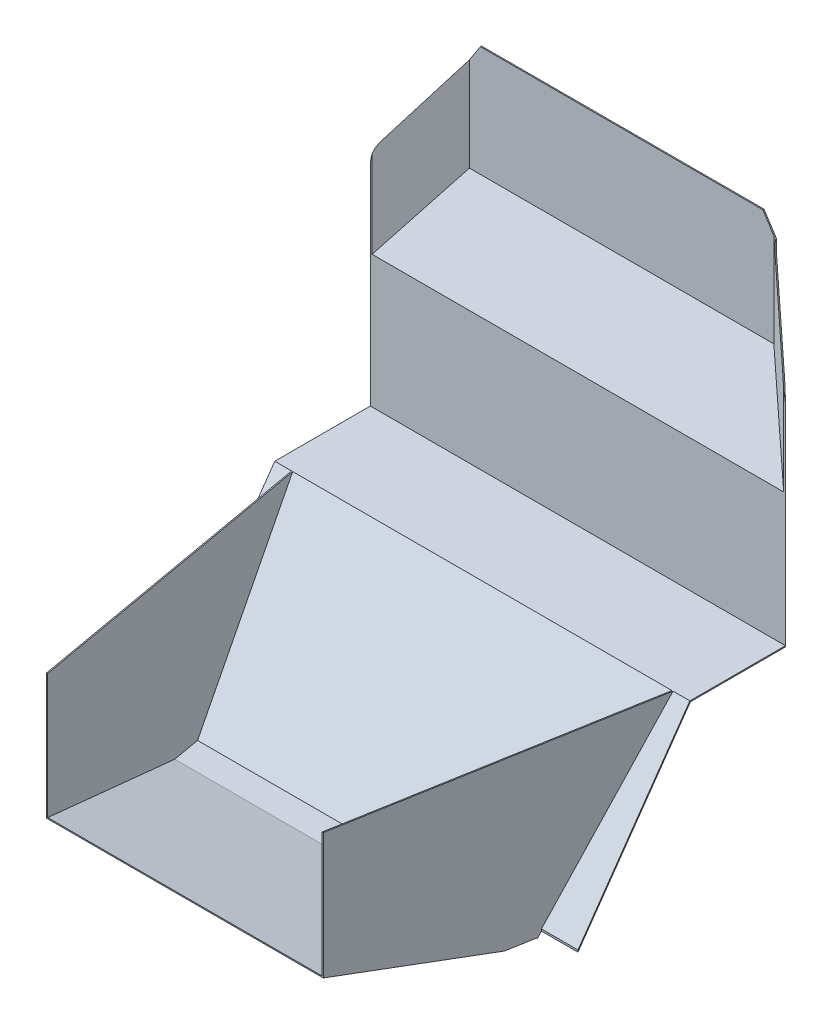
from build123d import *

# Parameters (mm, degrees)
SKETCH2_W                        = 750
SKETCH2_H                        = 2
CUT_EXTRUDE1_START               = -75.747152873
CUT_EXTRUDE1_DEPTH               = 12.429918895
BOSS_EXTRUDE8_DEPTH              = 2
BOSS_EXTRUDE9_REACH              = 1300.889
CUT_EXTRUDE2_DEPTH               = 1250.387389222
CUT_EXTRUDE2_DEPTH_BACK          = 1250.387389222
BOSS_EXTRUDE11_REACH             = 1244.792
CUT_EXTRUDE4_DEPTH               = 1243.792388557
CUT_EXTRUDE4_DEPTH_BACK          = 1243.792388557
SKETCH9_5_W                      = 96.83734937
SKETCH9_5_H                      = 2
CUT_EXTRUDE5_DEPTH               = 1250.387389222
CUT_EXTRUDE5_DEPTH_BACK          = 1250.387389222
BOSS_EXTRUDE12_REACH             = 1251.387
BOSS_EXTRUDE12_DIRECTION_2_REACH = 1251.387
CUT_EXTRUDE6_DEPTH               = 1250.387389222


# Read off the part's stored shape, not the designer's step: Cut-Extrude1
with BuildPart() as part:
    # Sweep1: sweep along a path in Sketch1
    with BuildLine(Plane(origin=(0, 0, 0), x_dir=(0, 0, -1), z_dir=(1, 0, 0))) as sweep1_path:
        Line((412.09972218, -74.6), (622.161983643, 225.4))
        Line((622.161983643, 225.4), (794.855002782, 225.4))
        Line((794.855002782, 225.4), (794.855002782, 464.406679147))
        Line((794.855002782, 464.406679147), (873.906828676, 608.165252796))
        Line((873.906828676, 608.165252796), (873.906828676, 808.165252796))
    # Sketch2 → Sweep1 (sweep)
    with BuildSketch(Plane(origin=(0, 808.165252796, -873.906828676), x_dir=(-1, 0, 0), z_dir=(0, -1, 0))):
        with Locations((0, 1)):
            Rectangle(SKETCH2_W, SKETCH2_H)
    sweep(path=sweep1_path.line, transition=Transition.RIGHT)

    # Cut-Extrude1 outline → Cut-Extrude1 (cut)
    with BuildSketch(Plane(origin=(0, 0, 0), x_dir=(1, 0, 0), z_dir=(0, 1, 0)).offset(CUT_EXTRUDE1_START)):
        Polygon((309.004636298, 420), (250, 84.852470497), (375, 84.852470497), (375, 420), align=None)
        Polygon((-375, 84.852470497), (-250, 84.852470497), (-309.004636298, 420), (-375, 420), align=None)
    extrude(amount=CUT_EXTRUDE1_DEPTH, mode=Mode.SUBTRACT)

    # Sketch5 → Boss-Extrude8 (add)
    with BuildSketch(Plane(origin=(0, -74.6, 0), x_dir=(1, 0, 0), z_dir=(0, 1, 0))):
        Polygon((250, 84.852470497), (307.902180066, 413.738026268), (-307.902180066, 413.738026268), (-250, 84.852470497), align=None)
    extrude(amount=BOSS_EXTRUDE8_DEPTH)

    # Boss-Extrude9: up to this face of the body (flat: up to its plane)
    boss_extrude9_end = Plane(part.part.faces().sort_by_distance((0, 225.4, -708.508493212))[0])
    # Sketch7 → Boss-Extrude9 (add, up to the picked face)
    with BuildSketch(Plane(origin=(0, -74.6, 0), x_dir=(1, 0, 0), z_dir=(0, 1, 0)), mode=Mode.PRIVATE) as boss_extrude9_sk1:
        Polygon((247.969240917, 84.852470497), (250, 84.852470497), (375, 794.855002782), (372.969240917, 794.855002782), align=None)
    boss_extrude9_tool1 = split(extrude(boss_extrude9_sk1.sketch, amount=BOSS_EXTRUDE9_REACH, mode=Mode.PRIVATE), bisect_by=boss_extrude9_end, keep=Keep.BOTH, mode=Mode.PRIVATE)
    # Sketch7 → Boss-Extrude9 (add, up to the picked face)
    with BuildSketch(Plane(origin=(0, -74.6, 0), x_dir=(1, 0, 0), z_dir=(0, 1, 0)), mode=Mode.PRIVATE) as boss_extrude9_sk2:
        Polygon((-250, 84.852470497), (-247.969240917, 84.852470497), (-372.969240917, 794.855002782), (-375, 794.855002782), align=None)
    boss_extrude9_tool2 = split(extrude(boss_extrude9_sk2.sketch, amount=BOSS_EXTRUDE9_REACH, mode=Mode.PRIVATE), bisect_by=boss_extrude9_end, keep=Keep.BOTH, mode=Mode.PRIVATE)
    add(boss_extrude9_tool1.solids().sort_by(Axis((311.48462, -74.6, -439.853737), (0, 1, 0)))[0])
    add(boss_extrude9_tool2.solids().sort_by(Axis((-311.48462, -74.6, -439.853737), (0, 1, 0)))[0])

    # Sketch8 → Cut-Extrude2 (cut, two sides: drawn at the far end of the back side and taken through both)
    with BuildSketch(Plane(origin=(0, 0, 0), x_dir=(0, 0, -1), z_dir=(1, 0, 0)).offset(-CUT_EXTRUDE2_DEPTH_BACK)):
        Polygon((794.855002782, -75.747152873), (413.738026268, -75.747152873), (623.203117744, 223.4), (794.855002782, 223.4), align=None)
    extrude(amount=CUT_EXTRUDE2_DEPTH + CUT_EXTRUDE2_DEPTH_BACK, mode=Mode.SUBTRACT)

    # Boss-Extrude11: up to this plane
    boss_extrude11_end = Plane(origin=(375, 608.747952644, -874.227251213), z_dir=(0, 0.48184672916330257, 0.8762555161564617))
    # Sketch9 → Boss-Extrude11 (add, up to the surface)
    with BuildSketch(Plane(origin=(0, 808.165252796, -873.906828676), x_dir=(-1, 0, 0), z_dir=(0, -1, 0)), mode=Mode.PRIVATE) as boss_extrude11_sk1:
        Polygon((278.16265063, 0), (375, -79.051825894), (371.837349371, -79.051825894), (275, 0), align=None)
    boss_extrude11_tool1 = split(extrude(boss_extrude11_sk1.sketch, amount=BOSS_EXTRUDE11_REACH, mode=Mode.PRIVATE), bisect_by=boss_extrude11_end, keep=Keep.BOTH, mode=Mode.PRIVATE)
    add(boss_extrude11_tool1.solids().sort_by_distance((-325, 808.165253, -834.380916))[0])
    # Sketch9 → Boss-Extrude11 (add, up to the surface)
    with BuildSketch(Plane(origin=(0, 808.165252796, -873.906828676), x_dir=(-1, 0, 0), z_dir=(0, -1, 0)), mode=Mode.PRIVATE) as boss_extrude11_sk2:
        Polygon((-278.16265063, 0), (-275, 0), (-371.837349371, -79.051825894), (-375, -79.051825894), align=None)
    boss_extrude11_tool2 = split(extrude(boss_extrude11_sk2.sketch, amount=BOSS_EXTRUDE11_REACH, mode=Mode.PRIVATE), bisect_by=boss_extrude11_end, keep=Keep.BOTH, mode=Mode.PRIVATE)
    add(boss_extrude11_tool2.solids().sort_by_distance((325, 808.165253, -834.380916))[0])

    # Sketch9<5> → Cut-Extrude4 (cut, two sides: drawn at the far end of the back side and taken through both)
    with BuildSketch(Plane(origin=(0, 808.165252796, -873.906828676), x_dir=(-1, 0, 0), z_dir=(0, -1, 0)).offset(-CUT_EXTRUDE4_DEPTH_BACK)):
        with Locations((326.581325315, 1)):
            Rectangle(SKETCH9_5_W, SKETCH9_5_H)
        Polygon((375, 0), (278.16265063, 0), (375, -79.051825894), align=None)
        with Locations((-326.581325315, 1)):
            Rectangle(SKETCH9_5_W, SKETCH9_5_H)
        Polygon((-278.16265063, 0), (-375, 0), (-375, -79.051825894), align=None)
    extrude(amount=CUT_EXTRUDE4_DEPTH + CUT_EXTRUDE4_DEPTH_BACK, mode=Mode.SUBTRACT)

    # Sketch10 → Cut-Extrude5 (cut, two sides: drawn at the far end of the back side and taken through both)
    with BuildSketch(Plane(origin=(0, 0, 0), x_dir=(0, 0, -1), z_dir=(1, 0, 0)).offset(-CUT_EXTRUDE5_DEPTH_BACK)):
        Polygon((363.31001592, -74.6), (84.852470497, -2.066737554), (84.852470497, -74.6), align=None)
    extrude(amount=CUT_EXTRUDE5_DEPTH + CUT_EXTRUDE5_DEPTH_BACK, mode=Mode.SUBTRACT)

    # Boss-Extrude12: up to this face of the body (flat: up to its plane)
    boss_extrude12_end = Plane(part.part.faces().sort_by_distance((290.698054418, 99.199933477, -316.018244063))[0])
    # Sketch10<3> → Boss-Extrude12 (add, up to the picked face)
    with BuildSketch(Plane(origin=(0, 0, 0), x_dir=(0, 0, -1), z_dir=(1, 0, 0)), mode=Mode.PRIVATE) as boss_extrude12_sk1:
        Polygon((371.244288377, -74.6), (84.852470497, 0), (84.852470497, -2.066737554), (363.31001592, -74.6), align=None)
    boss_extrude12_tool1 = split(extrude(boss_extrude12_sk1.sketch, amount=BOSS_EXTRUDE12_REACH, mode=Mode.PRIVATE), bisect_by=boss_extrude12_end, keep=Keep.BOTH, mode=Mode.PRIVATE)
    add(boss_extrude12_tool1.solids().sort_by(Axis((0, -37.814265, -226.074099), (1, 0, 0)))[0])

    # Boss-Extrude12 direction 2: up to this face of the body (flat: up to its plane)
    boss_extrude12_direction_2_end = Plane(part.part.faces().sort_by_distance((-290.698054418, 99.199933477, -316.018244063))[0])
    # Sketch10<3> → Boss-Extrude12 direction 2 (add, up to the picked face)
    with BuildSketch(Plane(origin=(0, 0, 0), x_dir=(0, 0, -1), z_dir=(1, 0, 0)), mode=Mode.PRIVATE) as boss_extrude12_direction_2_sk1:
        Polygon((371.244288377, -74.6), (84.852470497, 0), (84.852470497, -2.066737554), (363.31001592, -74.6), align=None)
    boss_extrude12_direction_2_tool1 = split(extrude(boss_extrude12_direction_2_sk1.sketch, amount=-BOSS_EXTRUDE12_DIRECTION_2_REACH, mode=Mode.PRIVATE), bisect_by=boss_extrude12_direction_2_end, keep=Keep.BOTH, mode=Mode.PRIVATE)
    add(boss_extrude12_direction_2_tool1.solids().sort_by(Axis((0, -37.814265, -226.074099), (-1, 0, 0)))[0])

    # Sketch11 → Cut-Extrude6 (cut, through all)
    with BuildSketch(Plane.XY):
        with BuildLine():
            Line((-132.091535468, 997.705769529), (-362.091535468, 643.574371694))
            ThreePointArc((-362.091535468, 643.574371694), (-371.70502864, 622.723084766), (-375, 600))
            Line((-375, 600), (-375, 997.705769529))
            Line((-375, 997.705769529), (-132.091535468, 997.705769529))
        make_face()
        with BuildLine():
            Line((132.091535468, 997.705769529), (362.091535468, 643.574371694))
            ThreePointArc((362.091535468, 643.574371694), (371.70502864, 622.723084766), (375, 600))
            Line((375, 600), (375, 997.705769529))
            Line((375, 997.705769529), (132.091535468, 997.705769529))
        make_face()
    extrude(amount=-CUT_EXTRUDE6_DEPTH, mode=Mode.SUBTRACT)


solid = part.part
